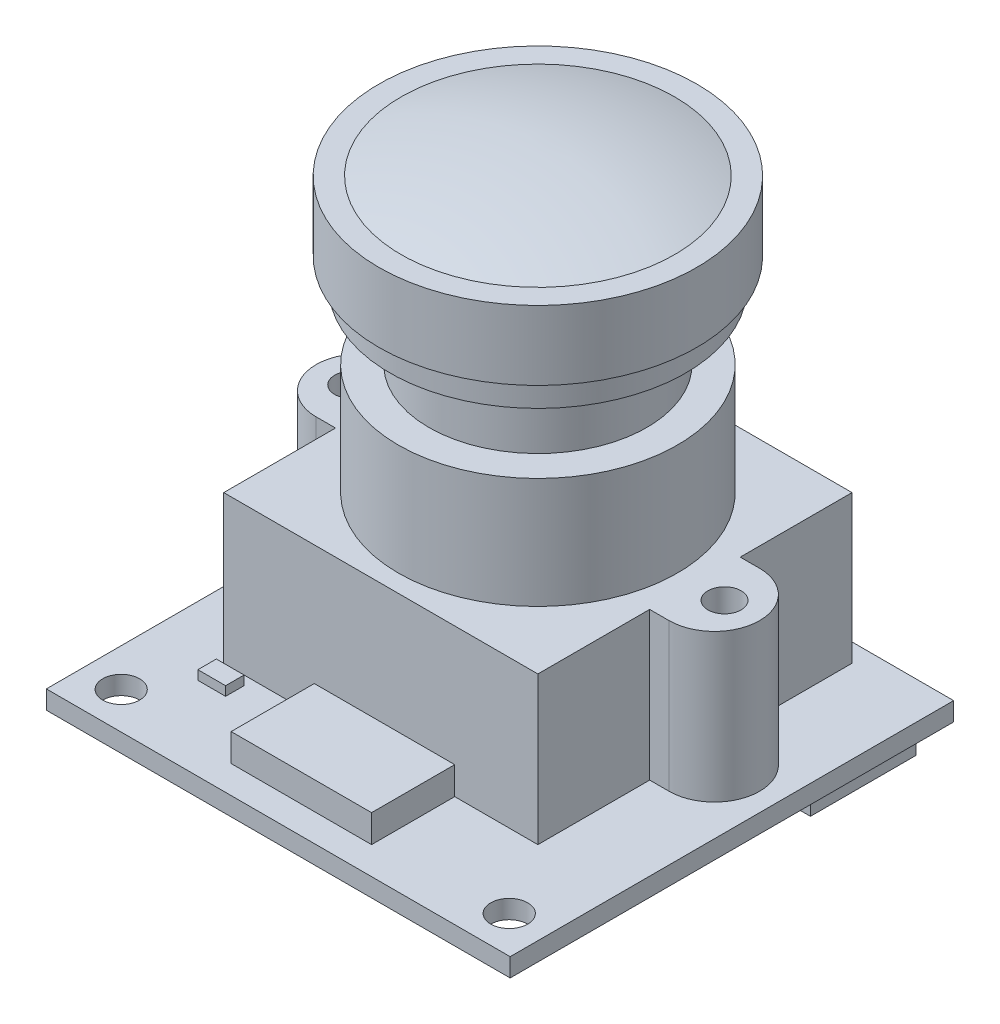
from build123d import *

# Parameters (mm, degrees)
SKETCH2_R                = 0.9
BOSS_EXTRUDE1_DEPTH      = 8
BOSS_EXTRUDE2_REACH      = 28.314
BOSS_EXTRUDE2_END_RADIUS = 7.55
SKETCH3_W                = 2.5
SKETCH3_H                = 6
SKETCH4_R                = 0.5
CUT_EXTRUDE1_DEPTH       = 8
SKETCH5_W                = 25.1
SKETCH5_H                = 24
BOSS_EXTRUDE3_DEPTH      = 1
SKETCH6_W                = 7.6
SKETCH6_H                = 4.5
BOSS_EXTRUDE4_DEPTH      = 1.5
SKETCH7_R                = 1
CUT_EXTRUDE2_DEPTH       = 31.907118921
SKETCH8_W                = 1.5
SKETCH8_H                = 1
BOSS_EXTRUDE5_DEPTH      = 0.5
SKETCH9_W                = 21
SKETCH9_H                = 5.7
BOSS_EXTRUDE6_DEPTH      = 2.6


with BuildPart() as part:
    # Sketch1 → Revolve1 (revolve)
    with BuildSketch(Plane(origin=(0, 0, 0), x_dir=(0, 0, -1), z_dir=(1, 0, 0))):
        with BuildLine():
            Line((0, 0), (0, 16))
            ThreePointArc((0, 16), (3.744412504, 15.710784808), (7.4, 14.85))
            Line((7.4, 14.85), (8.6, 14.85))
            Line((8.6, 14.85), (8.6, 11.1))
            Line((8.6, 11.1), (8, 11.1))
            Line((8, 11.1), (8, 9.6))
            Line((8, 9.6), (5.9, 9.6))
            Line((5.9, 9.6), (5.9, 6))
            Line((5.9, 6), (7.55, 6))
            Line((7.55, 6), (7.55, 0))
            Line((7.55, 0), (0, 0))
        make_face()
    revolve(axis=Axis((0, 0, 0), (0, 1, 0)))

    # Sketch2 → Boss-Extrude1 (add)
    with BuildSketch(Plane.XZ):
        with BuildLine():
            Line((-8.5, -8.5), (8.5, -8.5))
            Line((8.5, -8.5), (8.5, -2.45))
            Line((8.5, -2.45), (9.55, -2.45))
            ThreePointArc((9.55, -2.45), (12, 0), (9.55, 2.45))
            Line((9.55, 2.45), (8.5, 2.45))
            Line((8.5, 2.45), (8.5, 8.5))
            Line((8.5, 8.5), (-8.5, 8.5))
            Line((-8.5, 8.5), (-8.5, 2.45))
            Line((-8.5, 2.45), (-9.55, 2.45))
            ThreePointArc((-9.55, 2.45), (-12, 0), (-9.55, -2.45))
            Line((-9.55, -2.45), (-8.5, -2.45))
            Line((-8.5, -2.45), (-8.5, -8.5))
        make_face()
        with Locations((-10.1, 0)):
            Circle(SKETCH2_R, mode=Mode.SUBTRACT)
        with Locations((10.1, 0)):
            Circle(SKETCH2_R, mode=Mode.SUBTRACT)
    extrude(amount=BOSS_EXTRUDE1_DEPTH)

    # Boss-Extrude2: up to this cylinder (the profile starts outside it)
    boss_extrude2_end = Plane(origin=(0, 3, 0), z_dir=(0, -1, 0)) * Cylinder(BOSS_EXTRUDE2_END_RADIUS, 72.728, mode=Mode.PRIVATE)
    # Sketch3 → Boss-Extrude2 (add, up to the surface)
    with BuildSketch(Plane(origin=(0, 0, -8.5), x_dir=(-1, 0, 0), z_dir=(0, 0, -1)), mode=Mode.PRIVATE) as boss_extrude2_sk1:
        with Locations((0, 3)):
            Rectangle(SKETCH3_W, SKETCH3_H)
    boss_extrude2_tool1 = extrude(boss_extrude2_sk1.sketch, amount=-BOSS_EXTRUDE2_REACH, mode=Mode.PRIVATE) - boss_extrude2_end
    add(boss_extrude2_tool1.solids().sort_by_distance((0, 3, -8.5))[0])

    # Sketch4 → Cut-Extrude1 (cut)
    with BuildSketch(Plane(origin=(0, 0, -8.5), x_dir=(-1, 0, 0), z_dir=(0, 0, -1))):
        with Locations((0, 3.75)):
            Circle(SKETCH4_R)
    extrude(amount=-CUT_EXTRUDE1_DEPTH, mode=Mode.SUBTRACT)

    # Sketch5 → Boss-Extrude3 (add)
    with BuildSketch(Plane.XZ.offset(8)):
        with Locations((0.45, 2.5)):
            Rectangle(SKETCH5_W, SKETCH5_H)
    extrude(amount=BOSS_EXTRUDE3_DEPTH)

    # Sketch6 → Boss-Extrude4 (add)
    with BuildSketch(Plane(origin=(0, -8, 0), x_dir=(1, 0, 0), z_dir=(0, 1, 0))):
        with Locations((0.2, -10.75)):
            Rectangle(SKETCH6_W, SKETCH6_H)
    extrude(amount=BOSS_EXTRUDE4_DEPTH)

    # Sketch7 → Cut-Extrude2 (cut, through all)
    with BuildSketch(Plane(origin=(0, -8, 0), x_dir=(1, 0, 0), z_dir=(0, 1, 0))):
        with Locations((-10.05, -12.5)):
            Circle(SKETCH7_R)
        with Locations((10.95, -12.5)):
            Circle(SKETCH7_R)
    extrude(amount=-CUT_EXTRUDE2_DEPTH, mode=Mode.SUBTRACT)

    # Sketch8 → Boss-Extrude5 (add)
    with BuildSketch(Plane(origin=(0, -8, 0), x_dir=(1, 0, 0), z_dir=(0, 1, 0))):
        with Locations((-7.65, -9.5)):
            Rectangle(SKETCH8_W, SKETCH8_H)
    extrude(amount=BOSS_EXTRUDE5_DEPTH)

    # Sketch9 → Boss-Extrude6 (add)
    with BuildSketch(Plane.XZ.offset(9)):
        with Locations((0.45, -6.65)):
            Rectangle(SKETCH9_W, SKETCH9_H)
    extrude(amount=BOSS_EXTRUDE6_DEPTH)


solid = part.part
